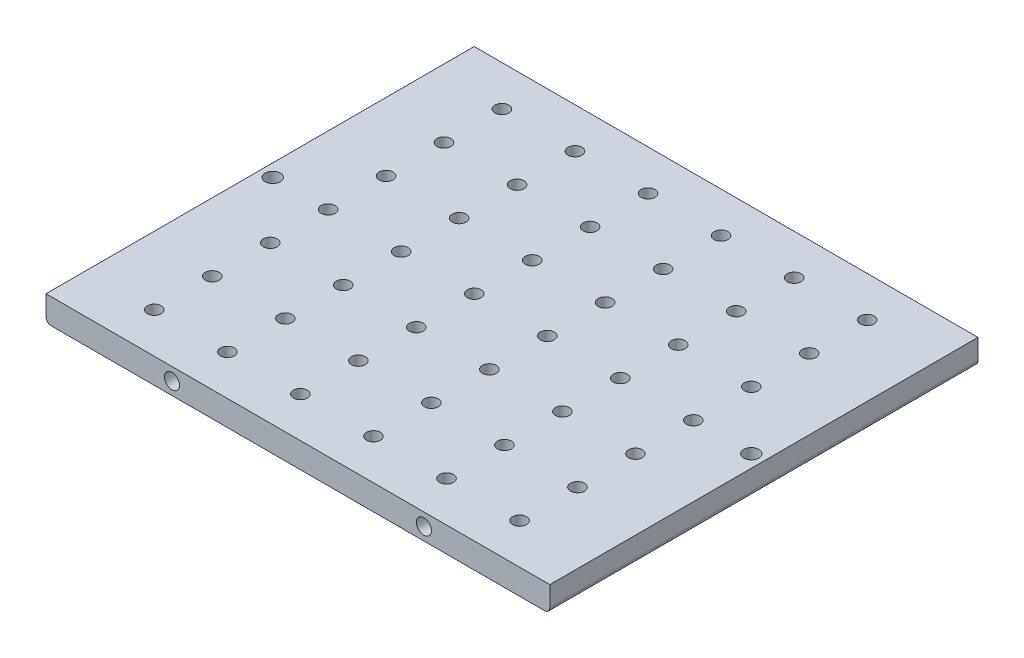
from build123d import *

# Parameters (mm, degrees)
ESQUISSE1_W                     = 100
ESQUISSE1_H                     = 85
BOSS_EXTRU_1_DEPTH              = 5
ESQUISSE2_R                     = 1.5
ENL_V_MAT_EXTRU_1_DEPTH         = 85
ESQUISSE3_R                     = 1.375
ENL_V_MAT_EXTRU_2_DEPTH         = 5
R_P_TITION_LIN_AIRE1_COUNT      = 7
R_P_TITION_LIN_AIRE1_PITCH      = 11.5
R_P_TITION_LIN_AIRE1_COUNT_DIR2 = 6
R_P_TITION_LIN_AIRE1_PITCH_DIR2 = 14.5
ESQUISSE4_R                     = 1.5
ENL_V_MAT_EXTRU_3_DEPTH         = 5
CONG_1_R                        = 1


with BuildPart() as part:
    # Esquisse1 → Boss.-Extru.1 (new body)
    with BuildSketch(Plane(origin=(0, 0, 0), x_dir=(1, 0, 0), z_dir=(0, 1, 0))):
        Rectangle(ESQUISSE1_W, ESQUISSE1_H)
    extrude(amount=BOSS_EXTRU_1_DEPTH)

    # Esquisse2 → Enlèv. mat.-Extru.1 (cut)
    with BuildSketch(Plane.XY.offset(42.5)):
        with Locations((-25, 2.5)):
            Circle(ESQUISSE2_R)
        with Locations((25, 2.5)):
            Circle(ESQUISSE2_R)
    extrude(amount=-ENL_V_MAT_EXTRU_1_DEPTH, mode=Mode.SUBTRACT)

    # Esquisse3 → Enlèv. mat.-Extru.2 (cut)
    with BuildSketch(Plane(origin=(0, 0, 0), x_dir=(1, 0, 0), z_dir=(0, 1, 0))):
        with Locations(Location((-36.5, 34.5, 0), (0, 0, 90))):
            Circle(ESQUISSE3_R)
    enl_v_mat_extru_2 = extrude(amount=ENL_V_MAT_EXTRU_2_DEPTH, mode=Mode.SUBTRACT)

    # Répétition linéaire1: Enl_v. mat.-Extru.2 7 × 6
    with Locations(*[(j * R_P_TITION_LIN_AIRE1_PITCH_DIR2, 0, i * R_P_TITION_LIN_AIRE1_PITCH) for i in range(R_P_TITION_LIN_AIRE1_COUNT) for j in range(R_P_TITION_LIN_AIRE1_COUNT_DIR2) if (i, j) != (0, 0)]):
        add(enl_v_mat_extru_2, mode=Mode.SUBTRACT)

    # Esquisse4 → Enlèv. mat.-Extru.3 (cut)
    with BuildSketch(Plane(origin=(0, 0, 0), x_dir=(1, 0, 0), z_dir=(0, 1, 0))):
        with Locations(Location((-47.5, 0, 0), (0, 0, 90))):
            Circle(ESQUISSE4_R)
        with Locations(Location((47.5, 0, 0), (0, 0, 90))):
            Circle(ESQUISSE4_R)
    extrude(amount=ENL_V_MAT_EXTRU_3_DEPTH, mode=Mode.SUBTRACT)

    # Congé1
    cong_1_edges = [part.edges().sort_by_distance(p)[0] for p in [
        (-50, 0, 0),
        (50, 0, 0),
    ]]
    fillet(cong_1_edges, radius=CONG_1_R - 0.0001)  # a hair under: the kernel refuses the full size


solid = part.part
